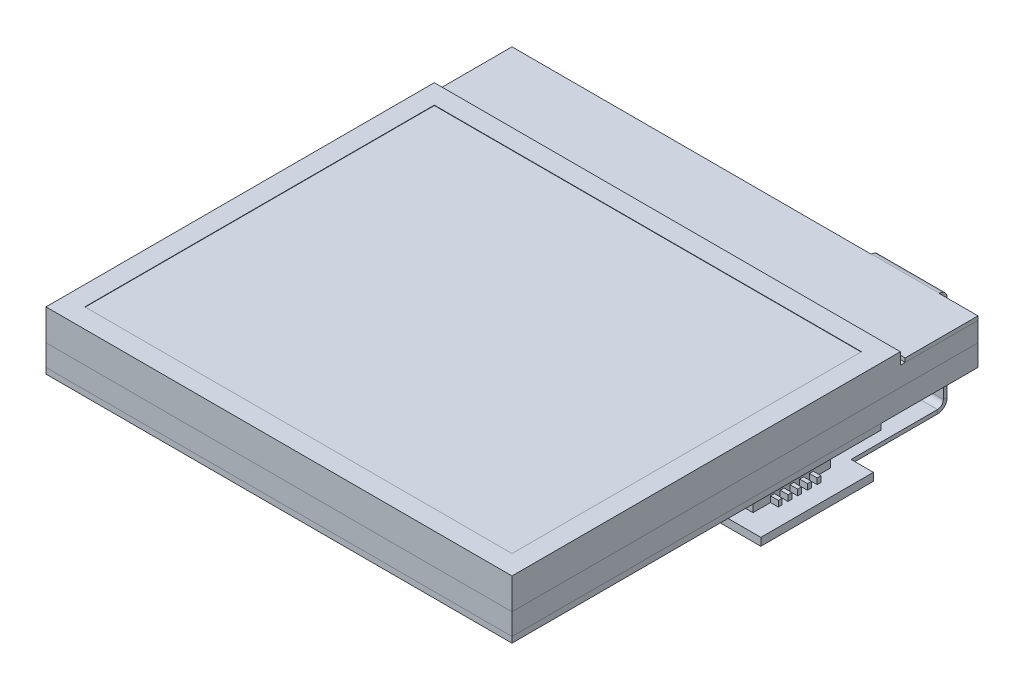
from build123d import *

# Parameters (mm, degrees)
SKETCH_1_W                 = 24
SKETCH_1_H                 = 24
EXTRUDE_1_DEPTH            = 1.1
EXTRUDE_START              = 1.1
SKETCH_1_2_W               = 24
SKETCH_1_2_H               = 24
EXTRUDE_2_DEPTH            = 1
SKETCH_2_W                 = 24
SKETCH_2_H                 = 20
EXTRUDE_3_DEPTH            = 0.6
SM_BASE_FLANGE_1_DEPTH     = 0.2
SKETCH_8_W                 = 3.2
SKETCH_8_H                 = 4
EXTRUDE_4_DEPTH            = 1.1
SKETCH_9_W                 = 2
SKETCH_9_H                 = 2.8
CUT_EXTRUDE_1_DEPTH        = 1
SKETCH_18_W                = 5.8
SKETCH_18_H                = 5.8
EXTRUDE_6_DEPTH            = 0.2
SKETCH_19_W                = 0.4
SKETCH_19_H                = 0.2
EXTRUDE_7_DEPTH            = 0.3
SKETCH_17_W                = 22
SKETCH_17_H                = 18
CUT_EXTRUDE_2_DEPTH        = 0.02
EXTRUDE_5_DEPTH            = 0.3
PATTERN_LINEAR_1_COUNT     = 3
PATTERN_LINEAR_1_PITCH     = 0.5
PATTERN_LINEAR_1_COL_COUNT = 3
PATTERN_LINEAR_1_COL_PITCH = 0.5
OTHER_START                = 5.35
OTHER_11_DEPTH             = 5.8
OTHER_START_2              = 6.65
OTHER_11_2_DEPTH           = 3.2
OTHER_11_3_OUTLINE_W       = 5.8
OTHER_11_3_OUTLINE_H       = 0.4
OTHER_11_3_DEPTH           = 5.8
OTHER_11_4_OUTLINE_W       = 2.8
OTHER_11_4_OUTLINE_H       = 1
OTHER_11_4_DEPTH           = 0.6
OTHER_START_3              = 9.25
OTHER_11_5_OUTLINE_W       = 2.8
OTHER_11_5_OUTLINE_H       = 1
OTHER_11_5_DEPTH           = 0.6
OTHER_START_4              = 6.5
OTHER_11_6_OUTLINE_W       = 0.2
OTHER_11_6_OUTLINE_H       = 0.1
OTHER_11_6_DEPTH           = 3.5
OTHER_START_5              = 6.25
OTHER_11_7_OUTLINE_W       = 0.2
OTHER_11_7_OUTLINE_H       = 0.3
OTHER_11_7_DEPTH           = 0.4
OTHER_START_6              = 9.85
OTHER_11_8_OUTLINE_W       = 0.2
OTHER_11_8_OUTLINE_H       = 0.3
OTHER_11_8_DEPTH           = 0.4
OTHER_12_DEPTH             = 5.8
OTHER_12_2_DEPTH           = 3.2
OTHER_12_3_OUTLINE_W       = 0.4
OTHER_12_3_OUTLINE_H       = 5.8
OTHER_12_3_DEPTH           = 5.8
OTHER_12_4_OUTLINE_W       = 1
OTHER_12_4_OUTLINE_H       = 2.8
OTHER_12_4_DEPTH           = 0.6
OTHER_12_5_OUTLINE_W       = 1
OTHER_12_5_OUTLINE_H       = 2.8
OTHER_12_5_DEPTH           = 0.6
OTHER_12_6_OUTLINE_W       = 0.1
OTHER_12_6_OUTLINE_H       = 0.2
OTHER_12_6_DEPTH           = 3.5
OTHER_12_7_OUTLINE_W       = 0.3
OTHER_12_7_OUTLINE_H       = 0.2
OTHER_12_7_DEPTH           = 0.4
OTHER_12_8_OUTLINE_W       = 0.3
OTHER_12_8_OUTLINE_H       = 0.2
OTHER_12_8_DEPTH           = 0.4


# Read off the part's stored shape, not the designer's step: Нарисованный сгиб11, Нарисованный сгиб12
# Sheet-metal steps are written as plain solids
with BuildPart() as part:
    # Sketch 1 → Бобышка-Вытянуть1 (new body)
    with BuildSketch(Plane(origin=(0, 0, 0), x_dir=(1, 0, 0), z_dir=(0, 1, 0))):
        Rectangle(SKETCH_1_W, SKETCH_1_H)
    extrude(amount=EXTRUDE_1_DEPTH)


with BuildPart() as body_2:
    # Эскиз1<2> → Бобышка-Вытянуть2 (new body)
    with BuildSketch(Plane(origin=(0, 0, 0), x_dir=(1, 0, 0), z_dir=(0, 1, 0)).offset(EXTRUDE_START)):
        Rectangle(SKETCH_1_2_W, SKETCH_1_2_H)
    extrude(amount=EXTRUDE_2_DEPTH)

    # Sketch 2 → Бобышка-Вытянуть3 (add)
    with BuildSketch(Plane(origin=(0, 2.1, 0), x_dir=(1, 0, 0), z_dir=(0, 1, 0))):
        with Locations((0, -2)):
            Rectangle(SKETCH_2_W, SKETCH_2_H)
    extrude(amount=EXTRUDE_3_DEPTH)

    # Эскиз17 → Вырез-Вытянуть2 (cut)
    with BuildSketch(Plane(origin=(0, 2.7, 0), x_dir=(1, 0, 0), z_dir=(0, 1, 0))):
        with Locations((0, -2)):
            Rectangle(SKETCH_17_W, SKETCH_17_H)
    extrude(amount=-CUT_EXTRUDE_2_DEPTH, mode=Mode.SUBTRACT)


with BuildPart() as body_3:
    # Эскиз3 → Базовая кромка1 (new body)
    with BuildSketch(Plane(origin=(0, 2.1, 0), x_dir=(1, 0, 0), z_dir=(0, 1, 0))):
        Polygon((-12, 12), (-12, 8.25), (12, 8.25), (12, 12), (10, 12), (10, 22), (11.15, 22), (11.15, 27.8), (5.35, 27.8), (5.35, 22), (6.5, 22), (6.5, 12), align=None)
    extrude(amount=SM_BASE_FLANGE_1_DEPTH)

    # Эскиз8 → Бобышка-Вытянуть4 (add)
    with BuildSketch(Plane.XZ.offset(-2.1)):
        with Locations((8.25, -24.9)):
            Rectangle(SKETCH_8_W, SKETCH_8_H)
    extrude(amount=EXTRUDE_4_DEPTH)

    # Эскиз9 → Вырез-Вытянуть1 (cut)
    with BuildSketch(Plane.XZ.offset(-1)):
        with Locations((8.25, -24.9)):
            Rectangle(SKETCH_9_W, SKETCH_9_H)
    extrude(amount=-CUT_EXTRUDE_1_DEPTH, mode=Mode.SUBTRACT)

    # Эскиз18 → Бобышка-Вытянуть6 (add)
    with BuildSketch(Plane(origin=(0, 2.3, 0), x_dir=(1, 0, 0), z_dir=(0, 1, 0))):
        with Locations((8.25, 24.9)):
            Rectangle(SKETCH_18_W, SKETCH_18_H)
    extrude(amount=EXTRUDE_6_DEPTH)

    # Эскиз19 → Бобышка-Вытянуть7 (add)
    with BuildSketch(Plane.XZ.offset(-2.1)):
        with Locations((6.45, -24.9)):
            Rectangle(SKETCH_19_W, SKETCH_19_H)
        with Locations((10.05, -24.9)):
            Rectangle(SKETCH_19_W, SKETCH_19_H)
    extrude_7 = extrude(amount=EXTRUDE_7_DEPTH)

    # Линейный массив1: Бобышка-Вытянуть7 ×3
    with Locations(*[(0, 0, -i * PATTERN_LINEAR_1_PITCH) for i in range(1, PATTERN_LINEAR_1_COUNT)]):
        add(extrude_7)

    # Линейный массив1 col: Бобышка-Вытянуть7 ×3
    with Locations(*[(0, 0, i * PATTERN_LINEAR_1_COL_PITCH) for i in range(1, PATTERN_LINEAR_1_COL_COUNT)]):
        add(extrude_7)

    # Other 11 outline → Other 11 (cut)
    with BuildSketch(Plane.YZ.offset(OTHER_START)):
        with BuildLine():
            ThreePointArc((2.3, -12.014380551), (2.246410161, -12.21438055), (2.1, -12.360790712))
            Line((2.1, -12.360790712), (2.1, -22.9))
            Line((2.1, -22.9), (1, -22.9))
            Line((1, -22.9), (1, -26.9))
            Line((1, -26.9), (2.1, -26.9))
            Line((2.1, -26.9), (2.1, -27.8))
            Line((2.1, -27.8), (2.5, -27.8))
            Line((2.5, -27.8), (2.5, -22))
            Line((2.5, -22), (2.3, -22))
            Line((2.3, -22), (2.3, -12.014380551))
        make_face()
    extrude(amount=OTHER_11_DEPTH, mode=Mode.SUBTRACT)

    # Other 11 2 outline → Other 11 2 (add)
    with BuildSketch(Plane.YZ.offset(OTHER_START_2)):
        with BuildLine():
            Line((1.9, -12.214380551), (-8.514380551, -12.214380551))
            Line((-8.514380551, -12.214380551), (-8.514380551, -11.114380551))
            Line((-8.514380551, -11.114380551), (-9.114380551, -11.114380551))
            Line((-9.114380551, -11.114380551), (-9.114380551, -12.114380551))
            Line((-9.114380551, -12.114380551), (-11.914380551, -12.114380551))
            Line((-11.914380551, -12.114380551), (-11.914380551, -11.114380551))
            Line((-11.914380551, -11.114380551), (-12.514380551, -11.114380551))
            Line((-12.514380551, -11.114380551), (-12.514380551, -12.214380551))
            Line((-12.514380551, -12.214380551), (-13.414380551, -12.214380551))
            Line((-13.414380551, -12.214380551), (-13.414380551, -12.614380551))
            Line((-13.414380551, -12.614380551), (-7.614380551, -12.614380551))
            Line((-7.614380551, -12.614380551), (-7.614380551, -12.414380551))
            Line((-7.614380551, -12.414380551), (1.9, -12.414380551))
            ThreePointArc((1.9, -12.414380551), (2.003527618, -12.400750881), (2.1, -12.360790712))
            Line((2.1, -12.360790712), (2.1, -12.014380551))
            ThreePointArc((2.1, -12.014380551), (2.041421356, -12.155801907), (1.9, -12.214380551))
        make_face()
    extrude(amount=OTHER_11_2_DEPTH)

    # Other 11 3 outline → Other 11 3 (add)
    with BuildSketch(Plane.YZ.offset(OTHER_START)):
        with Locations((-10.514380551, -12.414380551)):
            Rectangle(OTHER_11_3_OUTLINE_W, OTHER_11_3_OUTLINE_H)
    extrude(amount=OTHER_11_3_DEPTH)

    # Other 11 4 outline → Other 11 4 (add)
    with BuildSketch(Plane.YZ.offset(OTHER_START_2)):
        with Locations((-10.514380551, -11.614380551)):
            Rectangle(OTHER_11_4_OUTLINE_W, OTHER_11_4_OUTLINE_H)
    extrude(amount=OTHER_11_4_DEPTH)

    # Other 11 5 outline → Other 11 5 (add)
    with BuildSketch(Plane.YZ.offset(OTHER_START_3)):
        with Locations((-10.514380551, -11.614380551)):
            Rectangle(OTHER_11_5_OUTLINE_W, OTHER_11_5_OUTLINE_H)
    extrude(amount=OTHER_11_5_DEPTH)

    # Other 11 6 outline → Other 11 6 (add)
    with BuildSketch(Plane.YZ.offset(OTHER_START_4)):
        with BuildLine():
            Line((-7.614380551, -12.214380551), (-7.614380551, -12.414380551))
            Line((-7.614380551, -12.414380551), (1.9, -12.414380551))
            ThreePointArc((1.9, -12.414380551), (2.003527618, -12.400750881), (2.1, -12.360790712))
            Line((2.1, -12.360790712), (2.1, -12.014380551))
            ThreePointArc((2.1, -12.014380551), (2.041421356, -12.155801907), (1.9, -12.214380551))
            Line((1.9, -12.214380551), (-7.614380551, -12.214380551))
        make_face()
        with Locations((-9.514380551, -12.164380551)):
            Rectangle(OTHER_11_6_OUTLINE_W, OTHER_11_6_OUTLINE_H)
        with Locations((-10.014380551, -12.164380551)):
            Rectangle(OTHER_11_6_OUTLINE_W, OTHER_11_6_OUTLINE_H)
        with Locations((-11.514380551, -12.164380551)):
            Rectangle(OTHER_11_6_OUTLINE_W, OTHER_11_6_OUTLINE_H)
        with Locations((-10.514380551, -12.164380551)):
            Rectangle(OTHER_11_6_OUTLINE_W, OTHER_11_6_OUTLINE_H)
        with Locations((-11.014380551, -12.164380551)):
            Rectangle(OTHER_11_6_OUTLINE_W, OTHER_11_6_OUTLINE_H)
    extrude(amount=OTHER_11_6_DEPTH)

    # Other 11 7 outline → Other 11 7 (add)
    with BuildSketch(Plane.YZ.offset(OTHER_START_5)):
        with Locations((-9.514380551, -12.064380551)):
            Rectangle(OTHER_11_7_OUTLINE_W, OTHER_11_7_OUTLINE_H)
        with Locations((-10.014380551, -12.064380551)):
            Rectangle(OTHER_11_7_OUTLINE_W, OTHER_11_7_OUTLINE_H)
        with Locations((-11.514380551, -12.064380551)):
            Rectangle(OTHER_11_7_OUTLINE_W, OTHER_11_7_OUTLINE_H)
        with Locations((-10.514380551, -12.064380551)):
            Rectangle(OTHER_11_7_OUTLINE_W, OTHER_11_7_OUTLINE_H)
        with Locations((-11.014380551, -12.064380551)):
            Rectangle(OTHER_11_7_OUTLINE_W, OTHER_11_7_OUTLINE_H)
    extrude(amount=OTHER_11_7_DEPTH)

    # Other 11 8 outline → Other 11 8 (add)
    with BuildSketch(Plane.YZ.offset(OTHER_START_6)):
        with Locations((-9.514380551, -12.064380551)):
            Rectangle(OTHER_11_8_OUTLINE_W, OTHER_11_8_OUTLINE_H)
        with Locations((-10.014380551, -12.064380551)):
            Rectangle(OTHER_11_8_OUTLINE_W, OTHER_11_8_OUTLINE_H)
        with Locations((-11.514380551, -12.064380551)):
            Rectangle(OTHER_11_8_OUTLINE_W, OTHER_11_8_OUTLINE_H)
        with Locations((-10.514380551, -12.064380551)):
            Rectangle(OTHER_11_8_OUTLINE_W, OTHER_11_8_OUTLINE_H)
        with Locations((-11.014380551, -12.064380551)):
            Rectangle(OTHER_11_8_OUTLINE_W, OTHER_11_8_OUTLINE_H)
    extrude(amount=OTHER_11_8_DEPTH)

    # Other 12 outline → Other 12 (cut)
    with BuildSketch(Plane.YZ.offset(OTHER_START)):
        with BuildLine():
            ThreePointArc((-2.535840735, -12.414380551), (-2.759447533, -12.361594146), (-2.935840735, -12.214380551))
            Line((-2.935840735, -12.214380551), (-8.514380551, -12.214380551))
            Line((-8.514380551, -12.214380551), (-8.514380551, -11.114380551))
            Line((-8.514380551, -11.114380551), (-12.514380551, -11.114380551))
            Line((-12.514380551, -11.114380551), (-12.514380551, -12.214380551))
            Line((-12.514380551, -12.214380551), (-13.414380551, -12.214380551))
            Line((-13.414380551, -12.214380551), (-13.414380551, -12.614380551))
            Line((-13.414380551, -12.614380551), (-7.614380551, -12.614380551))
            Line((-7.614380551, -12.614380551), (-7.614380551, -12.414380551))
            Line((-7.614380551, -12.414380551), (-2.535840735, -12.414380551))
        make_face()
    extrude(amount=OTHER_12_DEPTH, mode=Mode.SUBTRACT)

    # Other 12 2 outline → Other 12 2 (add)
    with BuildSketch(Plane.YZ.offset(OTHER_START_2)):
        with BuildLine():
            Line((-2.835840735, -11.914380551), (-2.835840735, -6.564159265))
            Line((-2.835840735, -6.564159265), (-1.735840735, -6.564159265))
            Line((-1.735840735, -6.564159265), (-1.735840735, -5.964159265))
            Line((-1.735840735, -5.964159265), (-2.735840735, -5.964159265))
            Line((-2.735840735, -5.964159265), (-2.735840735, -3.164159265))
            Line((-2.735840735, -3.164159265), (-1.735840735, -3.164159265))
            Line((-1.735840735, -3.164159265), (-1.735840735, -2.564159265))
            Line((-1.735840735, -2.564159265), (-2.835840735, -2.564159265))
            Line((-2.835840735, -2.564159265), (-2.835840735, -1.664159265))
            Line((-2.835840735, -1.664159265), (-3.235840735, -1.664159265))
            Line((-3.235840735, -1.664159265), (-3.235840735, -7.464159265))
            Line((-3.235840735, -7.464159265), (-3.035840735, -7.464159265))
            Line((-3.035840735, -7.464159265), (-3.035840735, -11.914380551))
            ThreePointArc((-3.035840735, -11.914380551), (-3.010182384, -12.072494434), (-2.935840735, -12.214380551))
            Line((-2.935840735, -12.214380551), (-2.535840735, -12.214380551))
            ThreePointArc((-2.535840735, -12.214380551), (-2.747972769, -12.126512585), (-2.835840735, -11.914380551))
        make_face()
    extrude(amount=OTHER_12_2_DEPTH)

    # Other 12 3 outline → Other 12 3 (add)
    with BuildSketch(Plane.YZ.offset(OTHER_START)):
        with Locations((-3.035840735, -4.564159265)):
            Rectangle(OTHER_12_3_OUTLINE_W, OTHER_12_3_OUTLINE_H)
    extrude(amount=OTHER_12_3_DEPTH)

    # Other 12 4 outline → Other 12 4 (add)
    with BuildSketch(Plane.YZ.offset(OTHER_START_2)):
        with Locations((-2.235840735, -4.564159265)):
            Rectangle(OTHER_12_4_OUTLINE_W, OTHER_12_4_OUTLINE_H)
    extrude(amount=OTHER_12_4_DEPTH)

    # Other 12 5 outline → Other 12 5 (add)
    with BuildSketch(Plane.YZ.offset(OTHER_START_3)):
        with Locations((-2.235840735, -4.564159265)):
            Rectangle(OTHER_12_5_OUTLINE_W, OTHER_12_5_OUTLINE_H)
    extrude(amount=OTHER_12_5_DEPTH)

    # Other 12 6 outline → Other 12 6 (add)
    with BuildSketch(Plane.YZ.offset(OTHER_START_4)):
        with BuildLine():
            Line((-2.835840735, -7.464159265), (-3.035840735, -7.464159265))
            Line((-3.035840735, -7.464159265), (-3.035840735, -11.914380551))
            ThreePointArc((-3.035840735, -11.914380551), (-3.010182384, -12.072494434), (-2.935840735, -12.214380551))
            Line((-2.935840735, -12.214380551), (-2.535840735, -12.214380551))
            ThreePointArc((-2.535840735, -12.214380551), (-2.747972769, -12.126512585), (-2.835840735, -11.914380551))
            Line((-2.835840735, -11.914380551), (-2.835840735, -7.464159265))
        make_face()
        with Locations((-2.785840735, -5.564159265)):
            Rectangle(OTHER_12_6_OUTLINE_W, OTHER_12_6_OUTLINE_H)
        with Locations((-2.785840735, -5.064159265)):
            Rectangle(OTHER_12_6_OUTLINE_W, OTHER_12_6_OUTLINE_H)
        with Locations((-2.785840735, -3.564159265)):
            Rectangle(OTHER_12_6_OUTLINE_W, OTHER_12_6_OUTLINE_H)
        with Locations((-2.785840735, -4.564159265)):
            Rectangle(OTHER_12_6_OUTLINE_W, OTHER_12_6_OUTLINE_H)
        with Locations((-2.785840735, -4.064159265)):
            Rectangle(OTHER_12_6_OUTLINE_W, OTHER_12_6_OUTLINE_H)
    extrude(amount=OTHER_12_6_DEPTH)

    # Other 12 7 outline → Other 12 7 (add)
    with BuildSketch(Plane.YZ.offset(OTHER_START_5)):
        with Locations((-2.685840735, -5.564159265)):
            Rectangle(OTHER_12_7_OUTLINE_W, OTHER_12_7_OUTLINE_H)
        with Locations((-2.685840735, -5.064159265)):
            Rectangle(OTHER_12_7_OUTLINE_W, OTHER_12_7_OUTLINE_H)
        with Locations((-2.685840735, -3.564159265)):
            Rectangle(OTHER_12_7_OUTLINE_W, OTHER_12_7_OUTLINE_H)
        with Locations((-2.685840735, -4.564159265)):
            Rectangle(OTHER_12_7_OUTLINE_W, OTHER_12_7_OUTLINE_H)
        with Locations((-2.685840735, -4.064159265)):
            Rectangle(OTHER_12_7_OUTLINE_W, OTHER_12_7_OUTLINE_H)
    extrude(amount=OTHER_12_7_DEPTH)

    # Other 12 8 outline → Other 12 8 (add)
    with BuildSketch(Plane.YZ.offset(OTHER_START_6)):
        with Locations((-2.685840735, -5.564159265)):
            Rectangle(OTHER_12_8_OUTLINE_W, OTHER_12_8_OUTLINE_H)
        with Locations((-2.685840735, -5.064159265)):
            Rectangle(OTHER_12_8_OUTLINE_W, OTHER_12_8_OUTLINE_H)
        with Locations((-2.685840735, -3.564159265)):
            Rectangle(OTHER_12_8_OUTLINE_W, OTHER_12_8_OUTLINE_H)
        with Locations((-2.685840735, -4.564159265)):
            Rectangle(OTHER_12_8_OUTLINE_W, OTHER_12_8_OUTLINE_H)
        with Locations((-2.685840735, -4.064159265)):
            Rectangle(OTHER_12_8_OUTLINE_W, OTHER_12_8_OUTLINE_H)
    extrude(amount=OTHER_12_8_DEPTH)


with BuildPart() as body_4:
    # Эскиз15 → Бобышка-Вытянуть5 (new body)
    with BuildSketch(Plane.XZ):
        Polygon((-12, -7), (-12, 12), (12, 12), (12, -7), (10, -7), (10, 10), (-10, 10), (-10, -7), align=None)
    extrude(amount=EXTRUDE_5_DEPTH)


solid = Compound([part.part, body_2.part, body_3.part, body_4.part])
